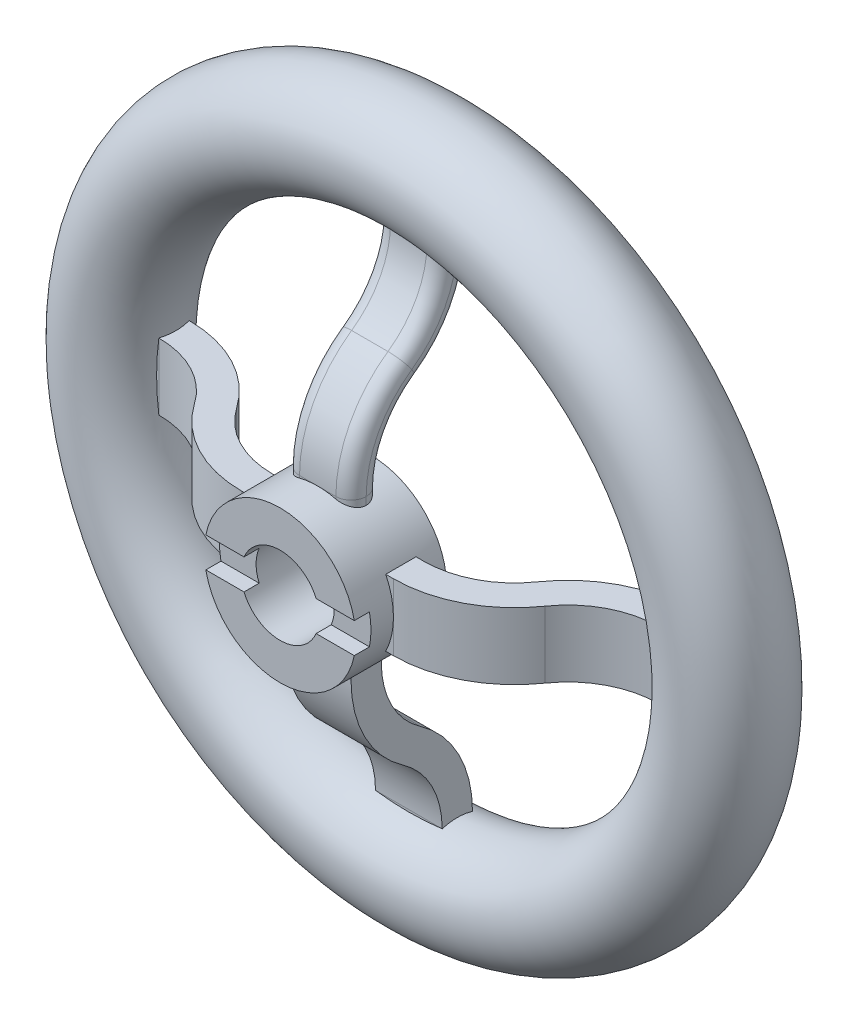
from build123d import *
from build123d.topology import SkipClean

# Parameters (mm, degrees)
CROQUIS1_R              = 25
CROQUIS1_R_2            = 12.9
SALIENTE_EXTRUIR1_DEPTH = 30
CROQUIS2_W              = 58.74150731
CROQUIS2_H              = 10
CORTAR_EXTRUIR1_DEPTH   = 5
CROQUIS3_W              = 10
CROQUIS3_H              = 5
CROQUIS3_H_2            = 3.5
SALIENTE_EXTRUIR2_DEPTH = 11
REDONDEO1_R             = 5
MATRIZC1_COUNT          = 4
CROQUIS5_R              = 17.5


with BuildPart() as part:
    # Croquis1 → Saliente-Extruir1 (new body)
    with BuildSketch(Plane.XY):
        Circle(CROQUIS1_R)
        Circle(CROQUIS1_R_2, mode=Mode.SUBTRACT)
    extrude(amount=SALIENTE_EXTRUIR1_DEPTH)

    # Croquis2 → Cortar-Extruir1 (cut)
    with BuildSketch(Plane.XY.offset(30)):
        Rectangle(CROQUIS2_W, CROQUIS2_H)
    extrude(amount=-CORTAR_EXTRUIR1_DEPTH, mode=Mode.SUBTRACT)

    # Croquis3 → Saliente-Extruir2 (add, symmetric)
    with BuildSketch(Plane(origin=(0, 0, 0), x_dir=(0, 0, -1), z_dir=(1, 0, 0))):
        with BuildLine():
            Line((22.5, 82.5), (12.5, 82.5))
            ThreePointArc((12.5, 82.5), (9.082703654, 68.594610167), (-0.390657761, 57.857142857))
            ThreePointArc((-0.390657761, 57.857142857), (-13.021806316, 43.540519778), (-17.578201443, 25))
            Line((-17.578201443, 25), (-7.578201443, 25))
            ThreePointArc((-7.578201443, 25), (-4.160905098, 38.905389833), (5.312456318, 49.642857143))
            ThreePointArc((5.312456318, 49.642857143), (17.943604873, 63.959480222), (22.5, 82.5))
        make_face()
        with Locations((17.5, 85)):
            Rectangle(CROQUIS3_W, CROQUIS3_H)
        with Locations((-12.578201443, 23.25)):
            Rectangle(CROQUIS3_W, CROQUIS3_H_2)
    saliente_extruir2 = extrude(amount=SALIENTE_EXTRUIR2_DEPTH, both=True)

    # Redondeo1
    redondeo1_edges = [part.edges().sort_by_distance(p)[0] for p in [
        (-11, 85, -12.5),
        (-11, 68.594610167, -9.082703654),
        (-11, 23.72497216, 17.578201443),
        (-11, 85, -22.5),
        (-11, 63.959480222, -17.943604873),
        (-11, 23.72497216, 7.578201443),
        (11, 85, -22.5),
        (11, 63.959480222, -17.943604873),
        (11, 23.72497216, 7.578201443),
        (11, 85, -12.5),
        (11, 68.594610167, -9.082703654),
        (11, 23.72497216, 17.578201443),
        (-11, 43.540519778, 13.021806316),
        (-11, 38.905389833, 4.160905098),
        (11, 38.905389833, 4.160905098),
        (11, 43.540519778, 13.021806316),
    ]]
    fillet(redondeo1_edges, radius=REDONDEO1_R - 0.0001)  # a hair under: the kernel refuses the full size

    # MatrizC1: Saliente-Extruir2 ×4 about axis
    matrizc1_axis = Axis((0, 0, 0), (0, 0, 1))
    for i in range(1, MATRIZC1_COUNT):
        add(saliente_extruir2.rotate(matrizc1_axis, i * 360 / MATRIZC1_COUNT))

    # Croquis5 → Revolución1 (revolve)
    with SkipClean():  # the faces are left unmerged after this step: merging them gives an invalid solid
        with BuildSketch(Plane(origin=(0, 0, 0), x_dir=(0, 0, -1), z_dir=(1, 0, 0)), mode=Mode.PRIVATE) as revoluci_n1_sk:
            with Locations((17.5, 100)):
                Circle(CROQUIS5_R)
        revolve(revoluci_n1_sk.sketch.rotate(Axis((0, 0, 0), (0, 0, -1)), 258.463040967), axis=Axis((0, 0, 0), (0, 0, -1)))


solid = part.part
